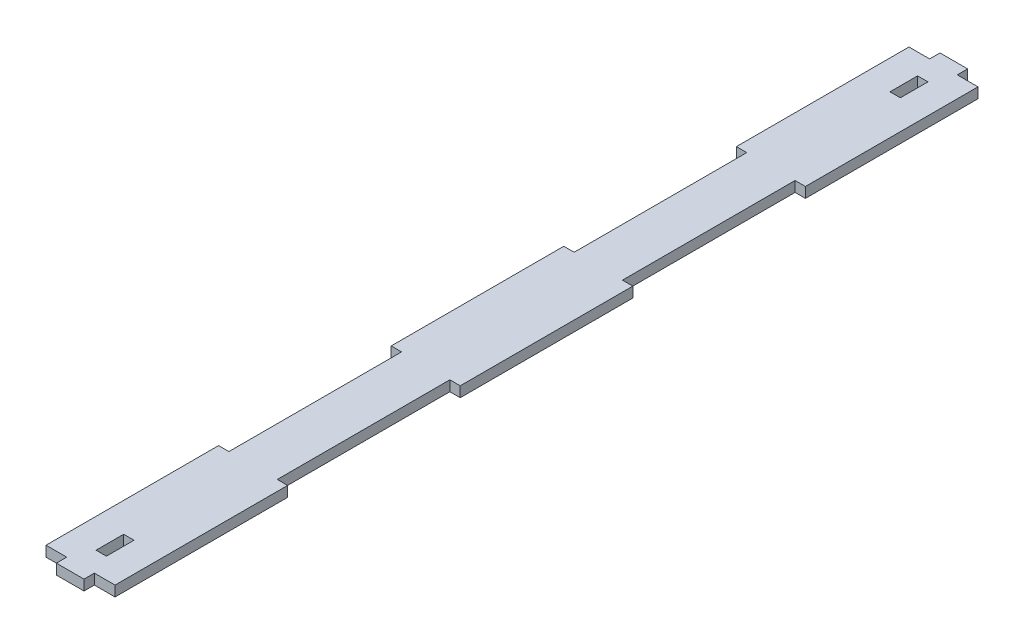
from build123d import *

# Parameters (mm, degrees)
SALIENTE_EXTRUIR1_DEPTH = 3


with BuildPart() as part:
    # Croquis1 → Saliente-Extruir1 (new body)
    with BuildSketch(Plane(origin=(0, 0, 0), x_dir=(1, 0, 0), z_dir=(0, 1, 0))):
        Polygon((20, 250), (14, 250), (14, 253), (10, 253), (6, 253), (6, 250), (3, 250), (0, 250), (0, 200), (3, 200), (3, 150), (0, 150), (0, 100), (3, 100), (3, 50), (0, 50), (0, 0), (6, 0), (6, -3), (10, -3), (14, -3), (14, 0), (20, 0), (20, 50), (17, 50), (17, 100), (20, 100), (20, 125), (20, 150), (17, 150), (17, 200), (20, 200), align=None)
        Polygon((11.5, 6), (10, 6), (8.5, 6), (8.5, 14), (11.5, 14), align=None, mode=Mode.SUBTRACT)
        Polygon((8.5, 244), (10, 244), (11.5, 244), (11.5, 236), (8.5, 236), align=None, mode=Mode.SUBTRACT)
    extrude(amount=SALIENTE_EXTRUIR1_DEPTH)


solid = part.part
